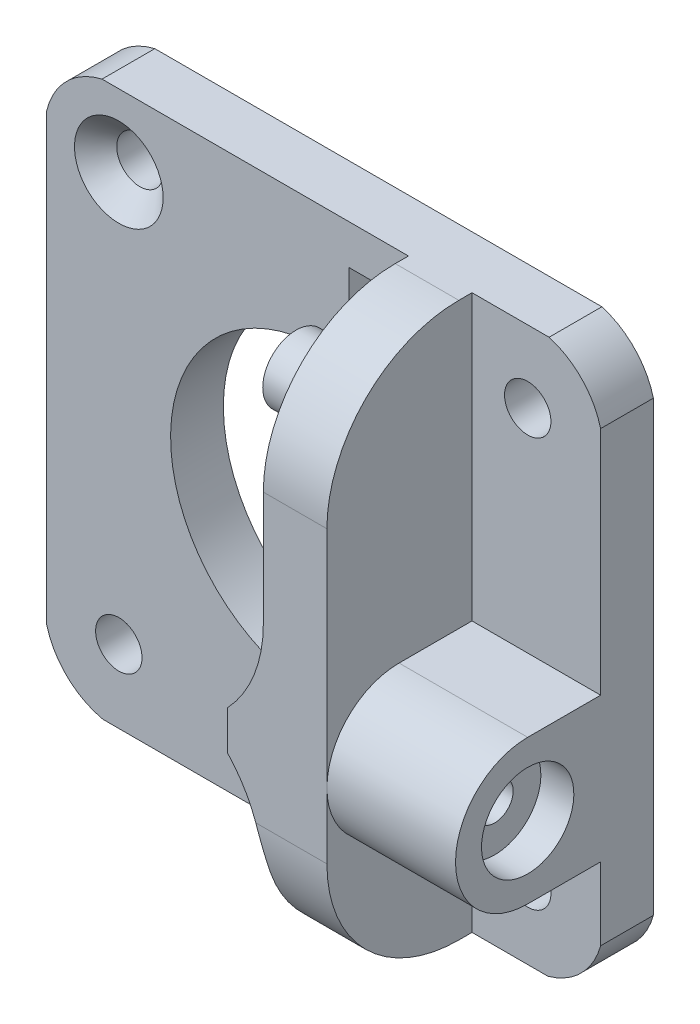
from build123d import *

# Parameters (mm, degrees)
CROQUIS2_R                                           = 1.75875
SALIENTE_EXTRUIR1_DEPTH                              = 4
CROQUIS3_W                                           = 4.82
CROQUIS3_H                                           = 42
SALIENTE_EXTRUIR2_DEPTH                              = 11
CROQUIS5_R                                           = 2.515
SALIENTE_EXTRUIR3_DEPTH                              = 3
CROQUIS6_W                                           = 2.7
CROQUIS6_H                                           = 3
SALIENTE_EXTRUIR4_DEPTH                              = 11
REDONDEO1_R                                          = 10
CORTAR_EXTRUIR1_REACH                                = 37.805
CROQUIS8_R                                           = 1.4
REDONDEO2_R                                          = 10
CROQUIS9_R                                           = 1.4
SALIENTE_EXTRUIR5_DEPTH                              = 9.75
CROQUIS10_R                                          = 3.5
CORTAR_EXTRUIR2_DEPTH                                = 2.5
REFRENTADO_PARA_TORNILLO_TAP_N_CON_CABEZ_D           = 3.3
REFRENTADO_PARA_TORNILLO_TAP_N_CON_CABEZ_CSINK_D     = 6.72
REFRENTADO_PARA_TORNILLO_TAP_N_CON_CABEZ_CSINK_ANGLE = 90


with BuildPart() as part:
    # Croquis2 → Saliente-Extruir1 (new body)
    with BuildSketch(Plane.XY):
        with BuildLine():
            Line((-10.901498769, 16.692640248), (-10.901498769, -17.009890921))
            ThreePointArc((-10.901498769, -17.009890921), (-9.344660807, -19.660096087), (-6.631805383, -21.105))
            Line((-6.631805383, -21.105), (27.102123863, -21.105))
            ThreePointArc((27.102123863, -21.105), (29.626712806, -19.633211575), (31.098501231, -17.108622633))
            Line((31.098501231, -17.108622633), (31.098501231, 16.847284537))
            ThreePointArc((31.098501231, 16.847284537), (29.679453987, 19.385312533), (27.194272919, 20.895))
            Line((27.194272919, 20.895), (-6.699139018, 20.895))
            ThreePointArc((-6.699139018, 20.895), (-9.401498769, 19.395), (-10.901498769, 16.692640248))
        make_face()
        with Locations((-5.428998769, 15.4225)):
            Circle(CROQUIS2_R, mode=Mode.SUBTRACT)
        with Locations((25.571001231, 15.4225)):
            Circle(CROQUIS2_R, mode=Mode.SUBTRACT)
        with Locations((25.571001231, -15.5775)):
            Circle(CROQUIS2_R, mode=Mode.SUBTRACT)
        with Locations((-5.428998769, -15.5775)):
            Circle(CROQUIS2_R, mode=Mode.SUBTRACT)
        with BuildLine():
            Line((20.363327993, -5.226), (21.350001231, -5.226))
            Line((21.350001231, -5.226), (21.350001231, 5.225999923))
            Line((21.350001231, 5.225999923), (20.363328032, 5.225999923))
            ThreePointArc((20.363328032, 5.225999923), (18.722008699, 7.645662593), (16.526001231, 9.57601173))
            Line((16.526001231, 9.57601173), (16.526001231, 17.886))
            Line((16.526001231, 17.886), (12.011001231, 17.886))
            Line((12.011001231, 17.886), (12.011001231, 11.390753987))
            ThreePointArc((12.011001231, 11.390753987), (-0.271544795, -5.190509466), (20.363327993, -5.226))
        make_face(mode=Mode.SUBTRACT)
    extrude(amount=SALIENTE_EXTRUIR1_DEPTH)

    # Croquis3 → Saliente-Extruir2 (add)
    with BuildSketch(Plane.XY.offset(4)):
        with Locations((18.938501231, -0.105)):
            Rectangle(CROQUIS3_W, CROQUIS3_H)
    extrude(amount=SALIENTE_EXTRUIR2_DEPTH)

    # Croquis5 → Saliente-Extruir3 (add)
    with BuildSketch(Plane.ZY.offset(-16.528501231)):
        with Locations(Location((9.53, 14.775, 0), (0, 0, 90))):
            Circle(CROQUIS5_R)
    extrude(amount=SALIENTE_EXTRUIR3_DEPTH)

    # Croquis6 → Saliente-Extruir4 (add)
    with BuildSketch(Plane.XY.offset(15)):
        with Locations((15.178501231, -6.105)):
            Rectangle(CROQUIS6_W, CROQUIS6_H)
    extrude(amount=-SALIENTE_EXTRUIR4_DEPTH)

    # Redondeo1
    # the kernel refuses this fillet: 10 mm, written as the material it adds along each edge
    with BuildSketch(Plane(origin=(16.528501231, -4.605, 15), x_dir=(0, 1, 0), z_dir=(0, 0, -1))) as redondeo1_piece_1:
        with BuildLine():
            CenterArc((6.83447145, -10), REDONDEO1_R, 90, 43.113605946)
            Line((0, -2.7), (-0.136689429, -2.554))
            ThreePointArc((-0.136689429, -2.554), (-0.2, -1.35), (-0.2, 0))
            Line((-0.2, 0), (0, 0.2))
            Line((0, 0.2), (6.83447145, 0.2))
            Line((6.83447145, 0.2), (6.83447145, 0))
        make_face()
    extrude(amount=11)
    with BuildSketch(Plane(origin=(16.528501231, -7.605, 15), x_dir=(0, -1, 0), z_dir=(0, 0, -1))) as redondeo1_piece_2:
        with BuildLine():
            CenterArc((6.83447145, 10), REDONDEO1_R, 226.886394054, 43.113605946)
            Line((0, 2.7), (-0.136689429, 2.554))
            ThreePointArc((-0.136689429, 2.554), (-0.2, 1.35), (-0.2, 0))
            Line((-0.2, 0), (0, -0.2))
            Line((0, -0.2), (6.83447145, -0.2))
            Line((6.83447145, -0.2), (6.83447145, 0))
        make_face()
    extrude(amount=11)

    # Croquis8 → Cortar-Extruir1 (cut, up to next)
    with BuildSketch(Plane.ZY.offset(-13.828501231), mode=Mode.PRIVATE) as cortar_extruir1_sk1:
        with Locations((9.53, -6.125)):
            Circle(CROQUIS8_R)
    cortar_extruir1_tool1 = extrude(cortar_extruir1_sk1.sketch, amount=-CORTAR_EXTRUIR1_REACH, mode=Mode.PRIVATE) & part.part
    add(cortar_extruir1_tool1.solids().sort_by_distance((13.828501, -6.125, 9.53))[0], mode=Mode.SUBTRACT)

    # Redondeo2
    redondeo2_edges = [part.edges().sort_by_distance(p)[0] for p in [
        (18.938501231, -21.105, 15),
        (18.938501231, 20.895, 15),
    ]]
    fillet(redondeo2_edges, radius=REDONDEO2_R)

    # Croquis9 → Saliente-Extruir5 (add)
    with BuildSketch(Plane(origin=(21.348501231, 0, 0), x_dir=(0, 0, -1), z_dir=(1, 0, 0))):
        with BuildLine():
            Line((-9.53, -0.655), (-4, -0.655))
            Line((-4, -0.655), (-4, -11.595))
            Line((-4, -11.595), (-9.53, -11.595))
            ThreePointArc((-9.53, -11.595), (-15, -6.125), (-9.53, -0.655))
        make_face()
        with Locations(Location((-9.53, -6.125, 0), (0, 0, 180))):
            Circle(CROQUIS9_R, mode=Mode.SUBTRACT)
    extrude(amount=SALIENTE_EXTRUIR5_DEPTH)

    # Croquis10 → Cortar-Extruir2 (cut)
    with BuildSketch(Plane(origin=(31.098501231, 0, 0), x_dir=(0, 0, -1), z_dir=(1, 0, 0))):
        with Locations(Location((-9.53, -6.125, 0), (0, 0, 90))):
            Circle(CROQUIS10_R)
    extrude(amount=-CORTAR_EXTRUIR2_DEPTH, mode=Mode.SUBTRACT)

    # Refrentado para tornillo tapón con cabeza plana de clavija de M31 (through all)
    with Locations(Plane.XY.offset(4)):
        with Locations((-5.428998769, 15.4225)):
            CounterSinkHole(REFRENTADO_PARA_TORNILLO_TAP_N_CON_CABEZ_D / 2, REFRENTADO_PARA_TORNILLO_TAP_N_CON_CABEZ_CSINK_D / 2, counter_sink_angle=REFRENTADO_PARA_TORNILLO_TAP_N_CON_CABEZ_CSINK_ANGLE)


solid = part.part
